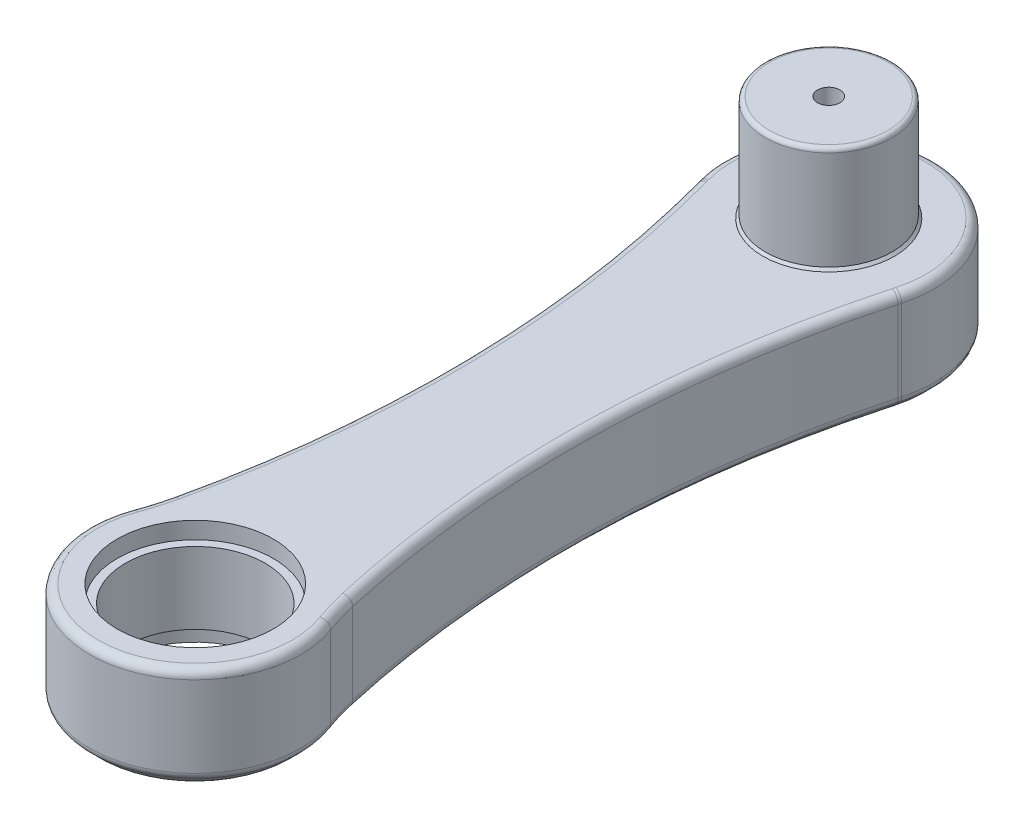
from build123d import *
from OCP.BRepAlgoAPI import BRepAlgoAPI_Cut
from OCP.TopTools import TopTools_ListOfShape

# Parameters (mm, degrees)
BOSS_EXTRUDE1_DEPTH = 25
FILLET1_R           = 2
CHAMFER1_SIZE       = 3
FILLET2_ANGLE       = 0.646799
FILLET2_2_ANGLE     = 211.518608
FILLET2_3_ANGLE     = 27.883082
FILLET2_4_ANGLE     = 0.646799
FILLET2_5_ANGLE     = 7.357492
FILLET2_6_ANGLE     = 27.883082
FILLET2_7_ANGLE     = 220.256139
FILLET2_8_ANGLE     = 7.357492
FILLET2_9_ANGLE     = 211.518608
FILLET2_10_ANGLE    = 220.256139
SKETCH2_R           = 18.485
CUT_EXTRUDE1_DEPTH  = 4
CUT_EXTRUDE2_START  = -4
SKETCH3_R           = 18.485
CUT_EXTRUDE2_DEPTH  = 4
SKETCH4_R           = 16.55
CUT_EXTRUDE3_DEPTH  = 17
SKETCH5_R           = 15.01
BOSS_EXTRUDE2_DEPTH = 25
SKETCH6_R           = 2.65
CUT_EXTRUDE4_DEPTH  = 50
SKETCH7_R           = 3
CUT_EXTRUDE5_DEPTH  = 8


with BuildPart() as part:
    # Sketch1 → Boss-Extrude1 (new body)
    with BuildSketch(Plane(origin=(0, 0, 0), x_dir=(1, 0, 0), z_dir=(0, 1, 0))):
        with BuildLine():
            ThreePointArc((-24.060278657, 68.210081667), (-23.969219176, 67.883890597), (-23.880002285, 67.55719075))
            ThreePointArc((-23.880002285, 67.55719075), (-14.848813015, 4.430409951), (-21.292911408, -59.012686046))
            ThreePointArc((-21.292911408, -59.012686046), (-22.264457345, -62.739854684), (-23.47314447, -66.397006991))
            ThreePointArc((-23.47314447, -66.397006991), (0, -100), (23.47314447, -66.397006991))
            ThreePointArc((23.47314447, -66.397006991), (22.264457345, -62.739854684), (21.292911408, -59.012686046))
            ThreePointArc((21.292911408, -59.012686046), (14.848813015, 4.430409951), (23.880002285, 67.55719075))
            ThreePointArc((23.880002285, 67.55719075), (23.969219176, 67.883890597), (24.060278657, 68.210081667))
            ThreePointArc((24.060278657, 68.210081667), (0, 100), (-24.060278657, 68.210081667))
        make_face()
    extrude(amount=BOSS_EXTRUDE1_DEPTH)

    # Fillet1
    fillet1_edges = [part.edges().sort_by_distance(p)[0] for p in [
        (0, 25, 100),
        (22.264457345, 25, 62.739854684),
        (14.848813015, 25, -4.430409951),
        (23.969219176, 25, -67.883890597),
        (0, 25, -100),
        (-23.969219176, 25, -67.883890597),
        (-14.848813015, 25, -4.430409951),
        (-22.264457345, 25, 62.739854684),
    ]]
    fillet(fillet1_edges, radius=FILLET1_R)

    # Chamfer1
    chamfer1_edges = [part.edges().sort_by_distance(p)[0] for p in [
        (-14.848813015, 0, -4.430409951),
        (-23.969219176, 0, -67.883890597),
        (0, 0, -100),
        (23.969219176, 0, -67.883890597),
        (14.848813015, 0, -4.430409951),
        (22.264457345, 0, 62.739854684),
        (0, 0, 100),
        (-22.264457345, 0, 62.739854684),
    ]]
    chamfer(chamfer1_edges, length=CHAMFER1_SIZE)


with BuildPart() as fillet2_tool:
    # Fillet2: read off the stored shape, not the designer's step
    # Fillet2 outline → Fillet2 (revolve)
    with BuildSketch(Plane(origin=(81.804947433, 0, -51.914277669), x_dir=(-0.9624111462665474, 0, -0.2715967333049319), z_dir=(0.2715967333049319, 0, -0.9624111462665474))):
        with BuildLine():
            ThreePointArc((60.585786438, 2.414213562), (60.152240935, 3.06306026), (60, 3.828427125))
            Line((60, 3.828427125), (60, 2.414213562))
            Line((60, 2.414213562), (60.585786438, 2.414213562))
        make_face()
        with BuildLine():
            ThreePointArc((63.828427125, 0), (63.06306026, 0.152240935), (62.414213562, 0.585786438))
            Line((62.414213562, 0.585786438), (62.414213562, 0))
            Line((62.414213562, 0), (63.828427125, 0))
        make_face()
    revolve(axis=Axis((81.804947433, 0, -51.914277669), (0, 1, 0)), revolution_arc=FILLET2_ANGLE)


with BuildPart() as part_1:
    add(part.part)

    # Fillet2: cut by fillet2_tool, with a tolerance
    fillet2_stock = TopTools_ListOfShape()
    fillet2_stock.Append(part_1.part.wrapped)
    fillet2_tools = TopTools_ListOfShape()
    fillet2_tools.Append(fillet2_tool.part.wrapped)
    fillet2_cut = BRepAlgoAPI_Cut()
    fillet2_cut.SetArguments(fillet2_stock)
    fillet2_cut.SetTools(fillet2_tools)
    fillet2_cut.SetFuzzyValue(0.00001)
    fillet2_cut.Build()
    add(Compound.cast(fillet2_cut.Shape()).solids(), mode=Mode.REPLACE)


with BuildPart() as fillet2_2_tool:
    # Fillet2 2 outline → Fillet2 2 (revolve)
    with BuildSketch(Plane(origin=(0, 0, -75), x_dir=(0.9624111462665468, 0, 0.2715967333049339), z_dir=(-0.2715967333049339, 0, 0.9624111462665468))):
        with BuildLine():
            Line((25, 2.414213562), (25, 3.828427125))
            ThreePointArc((25, 3.828427125), (24.847759065, 3.06306026), (24.414213562, 2.414213562))
            Line((24.414213562, 2.414213562), (25, 2.414213562))
        make_face()
    revolve(axis=Axis((0, 0, -75), (0, 1, 0)), revolution_arc=FILLET2_2_ANGLE)


with BuildPart() as part_2:
    add(part_1.part)

    # Fillet2 2: cut by fillet2_2_tool, with a tolerance
    fillet2_2_stock = TopTools_ListOfShape()
    fillet2_2_stock.Append(part_2.part.wrapped)
    fillet2_2_tools = TopTools_ListOfShape()
    fillet2_2_tools.Append(fillet2_2_tool.part.wrapped)
    fillet2_2_cut = BRepAlgoAPI_Cut()
    fillet2_2_cut.SetArguments(fillet2_2_stock)
    fillet2_2_cut.SetTools(fillet2_2_tools)
    fillet2_2_cut.SetFuzzyValue(0.00001)
    fillet2_2_cut.Build()
    add(Compound.cast(fillet2_2_cut.Shape()).solids(), mode=Mode.REPLACE)


with BuildPart() as fillet2_3_tool:
    # Fillet2 3 outline → Fillet2 3 (revolve)
    with BuildSketch(Plane(origin=(277.516276702, 0, 0.938518393), x_dir=(-0.965415752456716, 0, -0.2607152180223337), z_dir=(0.2607152180223337, 0, -0.965415752456716))):
        with BuildLine():
            ThreePointArc((263.308114897, 2.414213562), (262.874569394, 3.06306026), (262.722328459, 3.828427125))
            Line((262.722328459, 3.828427125), (262.722328459, 2.414213562))
            Line((262.722328459, 2.414213562), (263.308114897, 2.414213562))
        make_face()
        with BuildLine():
            ThreePointArc((266.550755584, 0), (265.785388719, 0.152240935), (265.136542022, 0.585786438))
            Line((265.136542022, 0.585786438), (265.136542022, 0))
            Line((265.136542022, 0), (266.550755584, 0))
        make_face()
    revolve(axis=Axis((277.516276702, 0, 0.938518393), (0, 1, 0)), revolution_arc=FILLET2_3_ANGLE)


with BuildPart() as part_3:
    add(part_2.part)

    # Fillet2 3: cut by fillet2_3_tool, with a tolerance
    fillet2_3_stock = TopTools_ListOfShape()
    fillet2_3_stock.Append(part_3.part.wrapped)
    fillet2_3_tools = TopTools_ListOfShape()
    fillet2_3_tools.Append(fillet2_3_tool.part.wrapped)
    fillet2_3_cut = BRepAlgoAPI_Cut()
    fillet2_3_cut.SetArguments(fillet2_3_stock)
    fillet2_3_cut.SetTools(fillet2_3_tools)
    fillet2_3_cut.SetFuzzyValue(0.00001)
    fillet2_3_cut.Build()
    add(Compound.cast(fillet2_3_cut.Shape()).solids(), mode=Mode.REPLACE)


with BuildPart() as fillet2_4_tool:
    # Fillet2 4 outline → Fillet2 4 (revolve)
    with BuildSketch(Plane(origin=(-81.804947433, 0, -51.914277669), x_dir=(0.9654157524567423, 0, -0.260715218022236), z_dir=(0.260715218022236, 0, 0.9654157524567423))):
        with BuildLine():
            ThreePointArc((60.585786438, 2.414213562), (60.152240935, 3.06306026), (60, 3.828427125))
            Line((60, 3.828427125), (60, 2.414213562))
            Line((60, 2.414213562), (60.585786438, 2.414213562))
        make_face()
        with BuildLine():
            ThreePointArc((63.828427125, 0), (63.06306026, 0.152240935), (62.414213562, 0.585786438))
            Line((62.414213562, 0.585786438), (62.414213562, 0))
            Line((62.414213562, 0), (63.828427125, 0))
        make_face()
    revolve(axis=Axis((-81.804947433, 0, -51.914277669), (0, 1, 0)), revolution_arc=FILLET2_4_ANGLE)


with BuildPart() as part_4:
    add(part_3.part)

    # Fillet2 4: cut by fillet2_4_tool, with a tolerance
    fillet2_4_stock = TopTools_ListOfShape()
    fillet2_4_stock.Append(part_4.part.wrapped)
    fillet2_4_tools = TopTools_ListOfShape()
    fillet2_4_tools.Append(fillet2_4_tool.part.wrapped)
    fillet2_4_cut = BRepAlgoAPI_Cut()
    fillet2_4_cut.SetArguments(fillet2_4_stock)
    fillet2_4_cut.SetTools(fillet2_4_tools)
    fillet2_4_cut.SetFuzzyValue(0.00001)
    fillet2_4_cut.Build()
    add(Compound.cast(fillet2_4_cut.Shape()).solids(), mode=Mode.REPLACE)


with BuildPart() as fillet2_5_tool:
    # Fillet2 5 outline → Fillet2 5 (revolve)
    with BuildSketch(Plane(origin=(79.808691197, 0, 45.74982377), x_dir=(-0.9752629964743126, 0, 0.22104770459777442), z_dir=(-0.22104770459777442, 0, -0.9752629964743126))):
        with BuildLine():
            ThreePointArc((60.585786438, 2.414213562), (60.152240935, 3.06306026), (60, 3.828427125))
            Line((60, 3.828427125), (60, 2.414213562))
            Line((60, 2.414213562), (60.585786438, 2.414213562))
        make_face()
        with BuildLine():
            ThreePointArc((63.828427125, 0), (63.06306026, 0.152240935), (62.414213562, 0.585786438))
            Line((62.414213562, 0.585786438), (62.414213562, 0))
            Line((62.414213562, 0), (63.828427125, 0))
        make_face()
    revolve(axis=Axis((79.808691197, 0, 45.74982377), (0, 1, 0)), revolution_arc=FILLET2_5_ANGLE)


with BuildPart() as part_5:
    add(part_4.part)

    # Fillet2 5: cut by fillet2_5_tool, with a tolerance
    fillet2_5_stock = TopTools_ListOfShape()
    fillet2_5_stock.Append(part_5.part.wrapped)
    fillet2_5_tools = TopTools_ListOfShape()
    fillet2_5_tools.Append(fillet2_5_tool.part.wrapped)
    fillet2_5_cut = BRepAlgoAPI_Cut()
    fillet2_5_cut.SetArguments(fillet2_5_stock)
    fillet2_5_cut.SetTools(fillet2_5_tools)
    fillet2_5_cut.SetFuzzyValue(0.00001)
    fillet2_5_cut.Build()
    add(Compound.cast(fillet2_5_cut.Shape()).solids(), mode=Mode.REPLACE)


with BuildPart() as fillet2_6_tool:
    # Fillet2 6 outline → Fillet2 6 (revolve)
    with BuildSketch(Plane(origin=(-277.516276702, 0, 0.938518393), x_dir=(0.975262996474313, 0, 0.22104770459777243), z_dir=(-0.22104770459777243, 0, 0.975262996474313))):
        with BuildLine():
            ThreePointArc((263.308114897, 2.414213562), (262.874569394, 3.06306026), (262.722328459, 3.828427125))
            Line((262.722328459, 3.828427125), (262.722328459, 2.414213562))
            Line((262.722328459, 2.414213562), (263.308114897, 2.414213562))
        make_face()
        with BuildLine():
            ThreePointArc((266.550755584, 0), (265.785388719, 0.152240935), (265.136542022, 0.585786438))
            Line((265.136542022, 0.585786438), (265.136542022, 0))
            Line((265.136542022, 0), (266.550755584, 0))
        make_face()
    revolve(axis=Axis((-277.516276702, 0, 0.938518393), (0, 1, 0)), revolution_arc=FILLET2_6_ANGLE)


with BuildPart() as part_6:
    add(part_5.part)

    # Fillet2 6: cut by fillet2_6_tool, with a tolerance
    fillet2_6_stock = TopTools_ListOfShape()
    fillet2_6_stock.Append(part_6.part.wrapped)
    fillet2_6_tools = TopTools_ListOfShape()
    fillet2_6_tools.Append(fillet2_6_tool.part.wrapped)
    fillet2_6_cut = BRepAlgoAPI_Cut()
    fillet2_6_cut.SetArguments(fillet2_6_stock)
    fillet2_6_cut.SetTools(fillet2_6_tools)
    fillet2_6_cut.SetFuzzyValue(0.00001)
    fillet2_6_cut.Build()
    add(Compound.cast(fillet2_6_cut.Shape()).solids(), mode=Mode.REPLACE)


with BuildPart() as fillet2_7_tool:
    # Fillet2 7 outline → Fillet2 7 (revolve)
    with BuildSketch(Plane(origin=(0, 0, 75), x_dir=(-0.9389257787826242, 0, -0.34411972035534766), z_dir=(0.34411972035534766, 0, -0.9389257787826242))):
        with BuildLine():
            Line((25, 2.414213562), (25, 3.828427125))
            ThreePointArc((25, 3.828427125), (24.847759065, 3.06306026), (24.414213562, 2.414213562))
            Line((24.414213562, 2.414213562), (25, 2.414213562))
        make_face()
    revolve(axis=Axis((0, 0, 75), (0, 1, 0)), revolution_arc=FILLET2_7_ANGLE)


with BuildPart() as part_7:
    add(part_6.part)

    # Fillet2 7: cut by fillet2_7_tool, with a tolerance
    fillet2_7_stock = TopTools_ListOfShape()
    fillet2_7_stock.Append(part_7.part.wrapped)
    fillet2_7_tools = TopTools_ListOfShape()
    fillet2_7_tools.Append(fillet2_7_tool.part.wrapped)
    fillet2_7_cut = BRepAlgoAPI_Cut()
    fillet2_7_cut.SetArguments(fillet2_7_stock)
    fillet2_7_cut.SetTools(fillet2_7_tools)
    fillet2_7_cut.SetFuzzyValue(0.00001)
    fillet2_7_cut.Build()
    add(Compound.cast(fillet2_7_cut.Shape()).solids(), mode=Mode.REPLACE)


with BuildPart() as fillet2_8_tool:
    # Fillet2 8 outline → Fillet2 8 (revolve)
    with BuildSketch(Plane(origin=(-79.808691197, 0, 45.74982377), x_dir=(0.9389257787826252, 0, 0.344119720355345), z_dir=(-0.344119720355345, 0, 0.9389257787826252))):
        with BuildLine():
            ThreePointArc((60.585786438, 2.414213562), (60.152240935, 3.06306026), (60, 3.828427125))
            Line((60, 3.828427125), (60, 2.414213562))
            Line((60, 2.414213562), (60.585786438, 2.414213562))
        make_face()
        with BuildLine():
            ThreePointArc((63.828427125, 0), (63.06306026, 0.152240935), (62.414213562, 0.585786438))
            Line((62.414213562, 0.585786438), (62.414213562, 0))
            Line((62.414213562, 0), (63.828427125, 0))
        make_face()
    revolve(axis=Axis((-79.808691197, 0, 45.74982377), (0, 1, 0)), revolution_arc=FILLET2_8_ANGLE)


with BuildPart() as part_8:
    add(part_7.part)

    # Fillet2 8: cut by fillet2_8_tool, with a tolerance
    fillet2_8_stock = TopTools_ListOfShape()
    fillet2_8_stock.Append(part_8.part.wrapped)
    fillet2_8_tools = TopTools_ListOfShape()
    fillet2_8_tools.Append(fillet2_8_tool.part.wrapped)
    fillet2_8_cut = BRepAlgoAPI_Cut()
    fillet2_8_cut.SetArguments(fillet2_8_stock)
    fillet2_8_cut.SetTools(fillet2_8_tools)
    fillet2_8_cut.SetFuzzyValue(0.00001)
    fillet2_8_cut.Build()
    add(Compound.cast(fillet2_8_cut.Shape()).solids(), mode=Mode.REPLACE)


with BuildPart() as fillet2_9_tool:
    # Fillet2 9 outline → Fillet2 9 (revolve)
    with BuildSketch(Plane(origin=(0, 0, -75), x_dir=(0.9624111462665468, 0, 0.2715967333049339), z_dir=(-0.2715967333049339, 0, 0.9624111462665468))):
        with BuildLine():
            ThreePointArc((22.585786438, 0.585786438), (21.93693974, 0.152240935), (21.171572875, 0))
            Line((21.171572875, 0), (22.585786438, 0))
            Line((22.585786438, 0), (22.585786438, 0.585786438))
        make_face()
    revolve(axis=Axis((0, 0, -75), (0, 1, 0)), revolution_arc=FILLET2_9_ANGLE)


with BuildPart() as part_9:
    add(part_8.part)

    # Fillet2 9: cut by fillet2_9_tool, with a tolerance
    fillet2_9_stock = TopTools_ListOfShape()
    fillet2_9_stock.Append(part_9.part.wrapped)
    fillet2_9_tools = TopTools_ListOfShape()
    fillet2_9_tools.Append(fillet2_9_tool.part.wrapped)
    fillet2_9_cut = BRepAlgoAPI_Cut()
    fillet2_9_cut.SetArguments(fillet2_9_stock)
    fillet2_9_cut.SetTools(fillet2_9_tools)
    fillet2_9_cut.SetFuzzyValue(0.00001)
    fillet2_9_cut.Build()
    add(Compound.cast(fillet2_9_cut.Shape()).solids(), mode=Mode.REPLACE)


with BuildPart() as fillet2_10_tool:
    # Fillet2 10 outline → Fillet2 10 (revolve)
    with BuildSketch(Plane(origin=(0, 0, 75), x_dir=(-0.9389257787826242, 0, -0.34411972035534766), z_dir=(0.34411972035534766, 0, -0.9389257787826242))):
        with BuildLine():
            ThreePointArc((22.585786438, 0.585786438), (21.93693974, 0.152240935), (21.171572875, 0))
            Line((21.171572875, 0), (22.585786438, 0))
            Line((22.585786438, 0), (22.585786438, 0.585786438))
        make_face()
    revolve(axis=Axis((0, 0, 75), (0, 1, 0)), revolution_arc=FILLET2_10_ANGLE)


with BuildPart() as part_10:
    add(part_9.part)

    # Fillet2 10: cut by fillet2_10_tool, with a tolerance
    fillet2_10_stock = TopTools_ListOfShape()
    fillet2_10_stock.Append(part_10.part.wrapped)
    fillet2_10_tools = TopTools_ListOfShape()
    fillet2_10_tools.Append(fillet2_10_tool.part.wrapped)
    fillet2_10_cut = BRepAlgoAPI_Cut()
    fillet2_10_cut.SetArguments(fillet2_10_stock)
    fillet2_10_cut.SetTools(fillet2_10_tools)
    fillet2_10_cut.SetFuzzyValue(0.00001)
    fillet2_10_cut.Build()
    add(Compound.cast(fillet2_10_cut.Shape()).solids(), mode=Mode.REPLACE)

    # Sketch2 → Cut-Extrude1 (cut)
    with BuildSketch(Plane(origin=(0, 25, 0), x_dir=(1, 0, 0), z_dir=(0, 1, 0))):
        with Locations(Location((0, -75, 0), (0, 0, 270))):
            Circle(SKETCH2_R)
    extrude(amount=-CUT_EXTRUDE1_DEPTH, mode=Mode.SUBTRACT)

    # Sketch3 → Cut-Extrude2 (cut)
    with BuildSketch(Plane.XZ.offset(CUT_EXTRUDE2_START)):
        with Locations(Location((0, 75, 0), (0, 0, 90))):
            Circle(SKETCH3_R)
    extrude(amount=CUT_EXTRUDE2_DEPTH, mode=Mode.SUBTRACT)

    # Sketch4 → Cut-Extrude3 (cut)
    with BuildSketch(Plane.XZ.offset(-4)):
        with Locations(Location((0, 75, 0), (0, 0, 270))):
            Circle(SKETCH4_R)
    extrude(amount=-CUT_EXTRUDE3_DEPTH, mode=Mode.SUBTRACT)

    # Sketch5 → Boss-Extrude2 (add)
    with BuildSketch(Plane(origin=(0, 25, 0), x_dir=(1, 0, 0), z_dir=(0, 1, 0))):
        with Locations(Location((0, 75, 0), (0, 0, 270))):
            Circle(SKETCH5_R)
    extrude(amount=BOSS_EXTRUDE2_DEPTH)

    # Chamfer2: read off the stored shape, not the designer's step
    # Chamfer2 outline → Chamfer2 (revolve)
    with BuildSketch(Plane.XY.offset(-75)):
        Polygon((15.59, 25), (15.01, 25.58), (15.01, 25), align=None)
    revolve(axis=Axis((0, 0, -75), (0, 1, 0)))

    # Sketch6 → Cut-Extrude4 (cut)
    with BuildSketch(Plane(origin=(0, 50, 0), x_dir=(1, 0, 0), z_dir=(0, 1, 0))):
        with Locations(Location((0, 75, 0), (0, 0, 270))):
            Circle(SKETCH6_R)
    extrude(amount=-CUT_EXTRUDE4_DEPTH, mode=Mode.SUBTRACT)

    # Sketch7 → Cut-Extrude5 (cut)
    with BuildSketch(Plane.XZ):
        with Locations(Location((0, -75, 0), (0, 0, 270))):
            Circle(SKETCH7_R)
    extrude(amount=-CUT_EXTRUDE5_DEPTH, mode=Mode.SUBTRACT)

    # Fillet3: read off the stored shape, not the designer's step
    # Fillet3 outline → Fillet3 (revolve, cut)
    with BuildSketch(Plane.XY.offset(-75)):
        with BuildLine():
            ThreePointArc((14.01, 50), (14.717106781, 49.707106781), (15.01, 49))
            Line((15.01, 49), (15.01, 50))
            Line((15.01, 50), (14.01, 50))
        make_face()
    revolve(axis=Axis((0, 0, -75), (0, 1, 0)), mode=Mode.SUBTRACT)


solid = part_10.part
